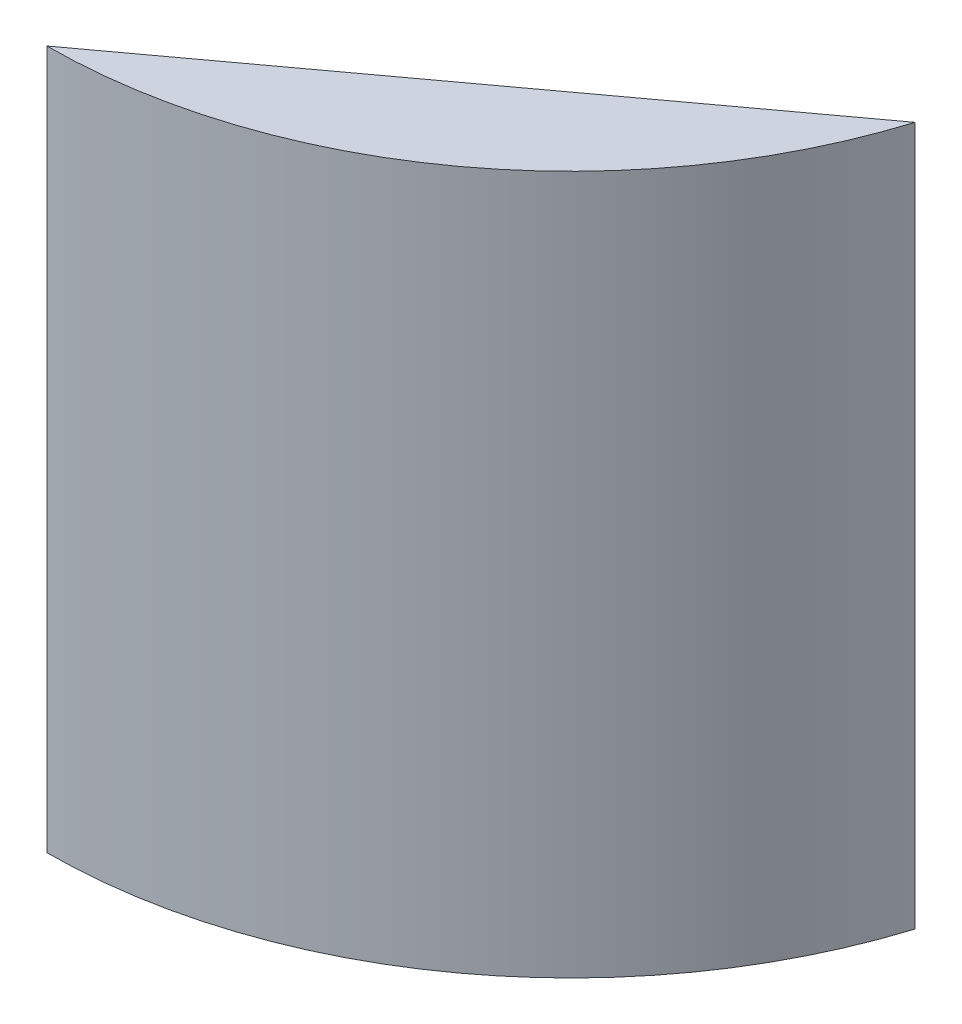
from build123d import *

# Parameters (mm, degrees)
SKETCH1_R           = 85.725
BOSS_EXTRUDE1_DEPTH = 114.3
CUT_EXTRUDE1_DEPTH  = 152.4
SKETCH3_R           = 2.778125
CUT_EXTRUDE2_DEPTH  = 3.175
SKETCH4_R           = 5.588
CUT_EXTRUDE3_DEPTH  = 6.096


with BuildPart() as part:
    # Sketch1 → Boss-Extrude1 (new body)
    with BuildSketch(Plane(origin=(0, 0, 0), x_dir=(1, 0, 0), z_dir=(0, 1, 0))):
        Circle(SKETCH1_R)
    extrude(amount=BOSS_EXTRUDE1_DEPTH)

    # Sketch2 → Cut-Extrude1 (cut)
    with BuildSketch(Plane(origin=(0, 114.3, 0), x_dir=(1, 0, 0), z_dir=(0, 1, 0))):
        Polygon((0, -85.725), (81.83903771, -25.517592593), (151.304734273, 75.062868172), (-38.51393236, 115.934796391), (-149.339737724, 18.86396687), (-68.774879215, -104.537816407), align=None)
    extrude(amount=-CUT_EXTRUDE1_DEPTH, mode=Mode.SUBTRACT)

    # Sketch3 → Cut-Extrude2 (cut)
    with BuildSketch(Plane(origin=(40.919518855, 0, 55.621296296), x_dir=(-0.8055023396641313, 0, 0.5925925925925928), z_dir=(-0.5925925925925928, 0, -0.8055023396641313))):
        with Locations((-36.83, 95.758)):
            Circle(SKETCH3_R)
        with Locations((11.176, 95.758)):
            Circle(SKETCH3_R)
        with Locations((-36.83, 70.358)):
            Circle(SKETCH3_R)
        with Locations((11.176, 70.358)):
            Circle(SKETCH3_R)
        with Locations((-36.83, 51.308)):
            Circle(SKETCH3_R)
        with Locations((6.096, 51.308)):
            Circle(SKETCH3_R)
        with Locations((-36.83, 30.48)):
            Circle(SKETCH3_R)
        with Locations((6.096, 30.48)):
            Circle(SKETCH3_R)
    extrude(amount=-CUT_EXTRUDE2_DEPTH, mode=Mode.SUBTRACT)

    # Sketch4 → Cut-Extrude3 (cut)
    with BuildSketch(Plane(origin=(0, 0, 0), x_dir=(-1, 0, 0), z_dir=(0, -1, 0))):
        with Locations((-45.859759427, -62.336492182)):
            Circle(SKETCH4_R)
    extrude(amount=-CUT_EXTRUDE3_DEPTH, mode=Mode.SUBTRACT)


solid = part.part
